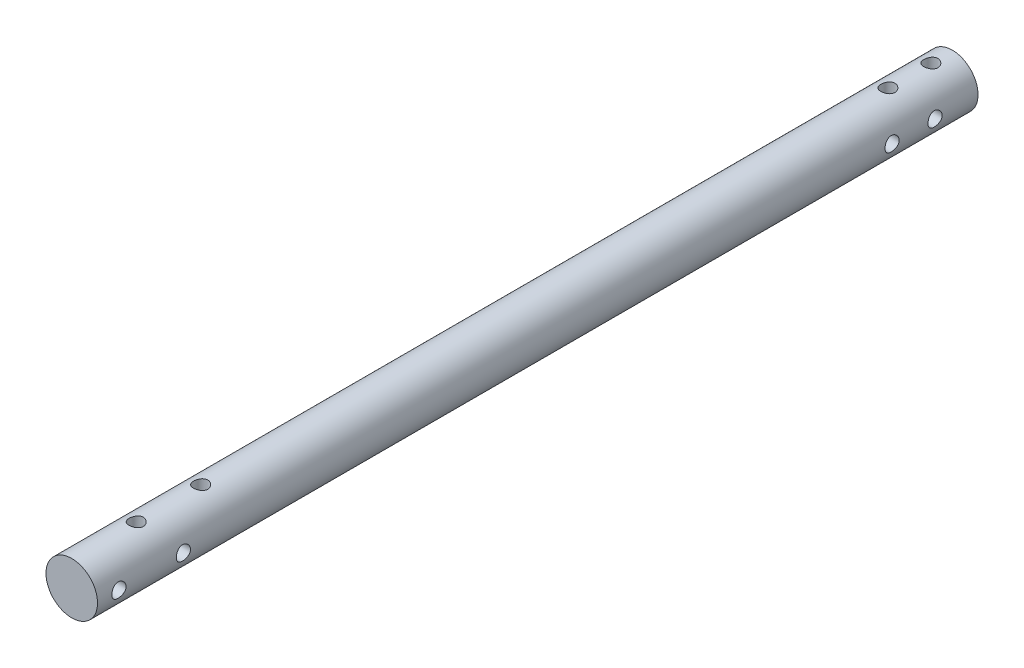
from build123d import *

# Parameters (mm, degrees)
SKETCH_1_W               = 8
SKETCH_1_H               = 8
SKETCH_1_W_2             = 4
SKETCH_1_H_2             = 4
EXTRUDE_1_DEPTH          = 205
SKETCH_7_R               = 6
EXTRUDE_2_DEPTH          = 205
CUT_EXTRUDE_1_DEPTH      = 206.175534604
CUT_EXTRUDE_1_DEPTH_BACK = 206.175534604
SKETCH_2_R               = 1.65
CUT_EXTRUDE_2_DEPTH      = 206.17553471
CUT_EXTRUDE_2_DEPTH_BACK = 206.17553471
SKETCH_3_R               = 1.65
CUT_EXTRUDE_3_DEPTH      = 206.17553471
CUT_EXTRUDE_3_DEPTH_BACK = 206.17553471
SKETCH_4_R               = 1.65
CUT_EXTRUDE_4_DEPTH      = 206.17553471
CUT_EXTRUDE_4_DEPTH_BACK = 206.17553471
SKETCH_5_R               = 1.65


with BuildPart() as part:
    # 草图1 → 凸台-拉伸1 (new body)
    with BuildSketch(Plane.XY):
        Rectangle(SKETCH_1_W, SKETCH_1_H)
        Rectangle(SKETCH_1_W_2, SKETCH_1_H_2, mode=Mode.SUBTRACT)
    extrude(amount=EXTRUDE_1_DEPTH)

    # 草图7 → 凸台-拉伸2 (add)
    with BuildSketch(Plane(origin=(0, 0, 0), x_dir=(-1, 0, 0), z_dir=(0, 0, -1))):
        Circle(SKETCH_7_R)
    extrude(amount=-EXTRUDE_2_DEPTH)

    # 草图2 → 切除-拉伸1 (cut, two sides: drawn at the far end of the back side and taken through both)
    with BuildSketch(Plane(origin=(0, 0, 0), x_dir=(1, 0, 0), z_dir=(0, 1, 0)).offset(-CUT_EXTRUDE_1_DEPTH_BACK)):
        with Locations((0, -5)):
            Circle(SKETCH_2_R)
        with Locations((0, -15)):
            Circle(SKETCH_2_R)
    extrude(amount=CUT_EXTRUDE_1_DEPTH + CUT_EXTRUDE_1_DEPTH_BACK, mode=Mode.SUBTRACT)

    # 草图3 → 切除-拉伸2 (cut, two sides: drawn at the far end of the back side and taken through both)
    with BuildSketch(Plane.ZY.offset(-CUT_EXTRUDE_2_DEPTH_BACK)):
        with Locations((10, 0)):
            Circle(SKETCH_3_R)
        with Locations((20, 0)):
            Circle(SKETCH_3_R)
    extrude(amount=CUT_EXTRUDE_2_DEPTH + CUT_EXTRUDE_2_DEPTH_BACK, mode=Mode.SUBTRACT)

    # 草图4 → 切除-拉伸3 (cut, two sides: drawn at the far end of the back side and taken through both)
    with BuildSketch(Plane.ZY.offset(-CUT_EXTRUDE_3_DEPTH_BACK)):
        with Locations((200, 0)):
            Circle(SKETCH_4_R)
        with Locations((185, 0)):
            Circle(SKETCH_4_R)
    extrude(amount=CUT_EXTRUDE_3_DEPTH + CUT_EXTRUDE_3_DEPTH_BACK, mode=Mode.SUBTRACT)

    # 草图5 → 切除-拉伸4 (cut, two sides: drawn at the far end of the back side and taken through both)
    with BuildSketch(Plane(origin=(0, 0, 0), x_dir=(1, 0, 0), z_dir=(0, 1, 0)).offset(-CUT_EXTRUDE_4_DEPTH_BACK)):
        with Locations((0, -190)):
            Circle(SKETCH_5_R)
        with Locations((0, -175)):
            Circle(SKETCH_5_R)
    extrude(amount=CUT_EXTRUDE_4_DEPTH + CUT_EXTRUDE_4_DEPTH_BACK, mode=Mode.SUBTRACT)


solid = part.part
